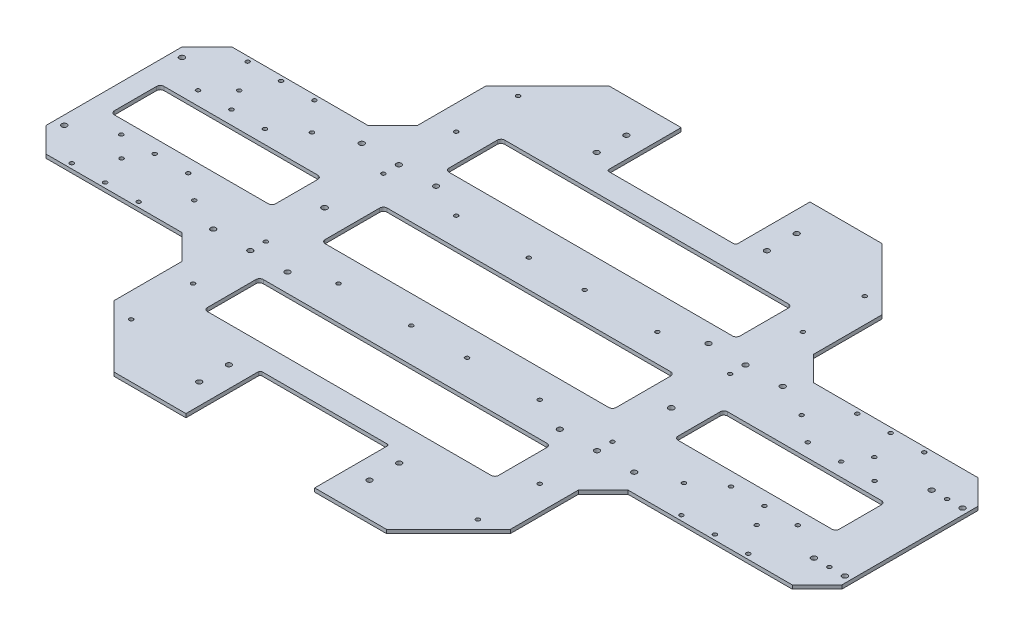
from build123d import *

# Parameters (mm, degrees)
EXTRUDE_1_DEPTH     = 3
CHAMFER_1_SIZE      = 20
CHAMFER_2_SIZE      = 50
SKETCH_2_W          = 104
SKETCH_2_H          = 93.088788678
CUT_EXTRUDE_1_DEPTH = 40
FILLET_1_R          = 1.5
SKETCH_3_R          = 2.1
CUT_EXTRUDE_2_DEPTH = 80
SKETCH_4_R          = 1.6
SKETCH_4_R_2        = 2.1
CUT_EXTRUDE_3_DEPTH = 29
EXTRUDE_2_DEPTH     = 3
SKETCH_6_R          = 2.15
CUT_EXTRUDE_4_DEPTH = 3
CUT_EXTRUDE_5_DEPTH = 15
SKETCH_8_R          = 2.240696867
SKETCH_8_R_2        = 1.6
SKETCH_8_R_3        = 2.15
CUT_EXTRUDE_6_DEPTH = 15


with BuildPart() as part:
    # 草图1 → 凸台-拉伸1 (new body)
    with BuildSketch(Plane(origin=(0, 0, 0), x_dir=(1, 0, 0), z_dir=(0, 1, 0))):
        Polygon((-310, -75), (-160, -75), (-160, -200), (160, -200), (160, -75), (310, -75), (310, 75), (160, 75), (160, 200), (-160, 200), (-160, 75), (-310, 75), align=None)
    extrude(amount=EXTRUDE_1_DEPTH)

    # 倒角1
    chamfer_1_edges = [part.edges().sort_by_distance(p)[0] for p in [
        (-160, 1.5, -75),
        (-310, 1.5, -75),
        (-310, 1.5, 75),
        (-160, 1.5, 75),
        (160, 1.5, 75),
        (160, 1.5, -75),
        (310, 1.5, 75),
        (310, 1.5, -75),
    ]]
    chamfer(chamfer_1_edges, length=CHAMFER_1_SIZE)

    # 倒角2
    chamfer_2_edges = [part.edges().sort_by_distance(p)[0] for p in [
        (160, 1.5, 200),
        (-160, 1.5, 200),
        (160, 1.5, -200),
        (-160, 1.5, -200),
    ]]
    chamfer(chamfer_2_edges, length=CHAMFER_2_SIZE)

    # 草图2 → 切除-拉伸1 (cut)
    with BuildSketch(Plane(origin=(0, 0, 0), x_dir=(-1, 0, 0), z_dir=(0, -1, 0))):
        with Locations((0, -186.544394339)):
            Rectangle(SKETCH_2_W, SKETCH_2_H)
        with Locations((0, 186.544394339)):
            Rectangle(SKETCH_2_W, SKETCH_2_H)
    extrude(amount=-CUT_EXTRUDE_1_DEPTH, mode=Mode.SUBTRACT)

    # 圆角1
    fillet_1_edges = [part.edges().sort_by_distance(p)[0] for p in [
        (-52, 1.5, -140),
        (52, 1.5, -140),
        (52, 1.5, 140),
        (-52, 1.5, 140),
    ]]
    fillet(fillet_1_edges, radius=FILLET_1_R)

    # 草图3 → 切除-拉伸2 (cut)
    with BuildSketch(Plane.XZ):
        with Locations((-68.75, 172.5)):
            Circle(SKETCH_3_R)
        with Locations((-68.75, 148.5)):
            Circle(SKETCH_3_R)
        with Locations((68.75, 172.5)):
            Circle(SKETCH_3_R)
        with Locations((68.75, 148.5)):
            Circle(SKETCH_3_R)
        with Locations((-68.75, -148.5)):
            Circle(SKETCH_3_R)
        with Locations((-68.75, -172.5)):
            Circle(SKETCH_3_R)
        with Locations((68.75, -148.5)):
            Circle(SKETCH_3_R)
        with Locations((68.75, -172.5)):
            Circle(SKETCH_3_R)
    extrude(amount=-CUT_EXTRUDE_2_DEPTH, mode=Mode.SUBTRACT)

    # 草图4 → 切除-拉伸3 (cut)
    with BuildSketch(Plane.XZ):
        with Locations((273.200177837, 71)):
            Circle(SKETCH_4_R)
        with Locations((273.200177837, 30.998400192)):
            Circle(SKETCH_4_R)
        with Locations((246.200177837, 71)):
            Circle(SKETCH_4_R)
        with Locations((219.200177837, 71)):
            Circle(SKETCH_4_R)
        with Locations((246.200177837, 30.998400192)):
            Circle(SKETCH_4_R)
        with Locations((219.200177837, 30.998400192)):
            Circle(SKETCH_4_R)
        with Locations((110, 60)):
            Circle(SKETCH_4_R_2)
        with Locations((140, 60)):
            Circle(SKETCH_4_R_2)
        with Locations((170, 60)):
            Circle(SKETCH_4_R_2)
        with Locations((170, -60)):
            Circle(SKETCH_4_R_2)
        with Locations((140, -60)):
            Circle(SKETCH_4_R_2)
        with Locations((110, -60)):
            Circle(SKETCH_4_R_2)
        with Locations((219.200177837, -30.998400192)):
            Circle(SKETCH_4_R)
        with Locations((246.200177837, -30.998400192)):
            Circle(SKETCH_4_R)
        with Locations((219.200177837, -71)):
            Circle(SKETCH_4_R)
        with Locations((246.200177837, -71)):
            Circle(SKETCH_4_R)
        with Locations((273.200177837, -30.998400192)):
            Circle(SKETCH_4_R)
        with Locations((273.200177837, -71)):
            Circle(SKETCH_4_R)
        with Locations((-273.200177837, -71)):
            Circle(SKETCH_4_R)
        with Locations((-273.200177837, -30.998400192)):
            Circle(SKETCH_4_R)
        with Locations((-246.200177837, -71)):
            Circle(SKETCH_4_R)
        with Locations((-219.200177837, -71)):
            Circle(SKETCH_4_R)
        with Locations((-246.200177837, -30.998400192)):
            Circle(SKETCH_4_R)
        with Locations((-219.200177837, -30.998400192)):
            Circle(SKETCH_4_R)
        with Locations((-110, -60)):
            Circle(SKETCH_4_R_2)
        with Locations((-140, -60)):
            Circle(SKETCH_4_R_2)
        with Locations((-170, -60)):
            Circle(SKETCH_4_R_2)
        with Locations((-170, 60)):
            Circle(SKETCH_4_R_2)
        with Locations((-140, 60)):
            Circle(SKETCH_4_R_2)
        with Locations((-110, 60)):
            Circle(SKETCH_4_R_2)
        with Locations((-219.200177837, 30.998400192)):
            Circle(SKETCH_4_R)
        with Locations((-246.200177837, 30.998400192)):
            Circle(SKETCH_4_R)
        with Locations((-219.200177837, 71)):
            Circle(SKETCH_4_R)
        with Locations((-246.200177837, 71)):
            Circle(SKETCH_4_R)
        with Locations((-273.200177837, 30.998400192)):
            Circle(SKETCH_4_R)
        with Locations((-273.200177837, 71)):
            Circle(SKETCH_4_R)
    extrude(amount=-CUT_EXTRUDE_3_DEPTH, mode=Mode.SUBTRACT)

    # 草图5 → 凸台-拉伸2 (add)
    with BuildSketch(Plane.XZ):
        Polygon((310, 55), (290, 75), (312.700177837, 75), (332.700177837, 55), (332.700177837, -55), (312.700177837, -75), (290, -75), (310, -55), align=None)
    extrude(amount=-EXTRUDE_2_DEPTH)

    # 草图6 → 切除-拉伸4 (cut)
    with BuildSketch(Plane.XZ):
        with Locations((302.700177837, 47.5)):
            Circle(SKETCH_6_R)
        with Locations((327.700177837, 47.5)):
            Circle(SKETCH_6_R)
        with Locations((327.700177837, -47.5)):
            Circle(SKETCH_6_R)
        with Locations((302.700177837, -47.5)):
            Circle(SKETCH_6_R)
    extrude(amount=-CUT_EXTRUDE_4_DEPTH, mode=Mode.SUBTRACT)

    # 草图7 → 切除-拉伸5 (cut)
    with BuildSketch(Plane.XZ):
        with BuildLine():
            Line((289.700177837, -20), (165.5, -20))
            ThreePointArc((165.5, -20), (163.378679656, -19.121320344), (162.5, -17))
            Line((162.5, -17), (162.5, 17))
            ThreePointArc((162.5, 17), (163.378679656, 19.121320344), (165.5, 20))
            Line((165.5, 20), (289.700177837, 20))
            ThreePointArc((289.700177837, 20), (291.82149818, 19.121320344), (292.700177837, 17))
            Line((292.700177837, 17), (292.700177837, -17))
            ThreePointArc((292.700177837, -17), (291.82149818, -19.121320344), (289.700177837, -20))
        make_face()
        with BuildLine():
            Line((114.5, -25), (-114.5, -25))
            ThreePointArc((-114.5, -25), (-116.621320344, -24.121320344), (-117.5, -22))
            Line((-117.5, -22), (-117.5, 22))
            ThreePointArc((-117.5, 22), (-116.621320344, 24.121320344), (-114.5, 25))
            Line((-114.5, 25), (114.5, 25))
            ThreePointArc((114.5, 25), (116.621320344, 24.121320344), (117.5, 22))
            Line((117.5, 22), (117.5, -22))
            ThreePointArc((117.5, -22), (116.621320344, -24.121320344), (114.5, -25))
        make_face()
        with BuildLine():
            Line((114.5, -120), (-114.5, -120))
            ThreePointArc((-114.5, -120), (-116.621320344, -119.121320344), (-117.5, -117))
            Line((-117.5, -117), (-117.5, -78))
            ThreePointArc((-117.5, -78), (-116.621320344, -75.878679656), (-114.5, -75))
            Line((-114.5, -75), (114.5, -75))
            ThreePointArc((114.5, -75), (116.621320344, -75.878679656), (117.5, -78))
            Line((117.5, -78), (117.5, -117))
            ThreePointArc((117.5, -117), (116.621320344, -119.121320344), (114.5, -120))
        make_face()
        with BuildLine():
            Line((-162.5, -17), (-162.5, 17))
            ThreePointArc((-162.5, 17), (-163.378679656, 19.121320344), (-165.5, 20))
            Line((-165.5, 20), (-289.700177837, 20))
            ThreePointArc((-289.700177837, 20), (-291.82149818, 19.121320344), (-292.700177837, 17))
            Line((-292.700177837, 17), (-292.700177837, -17))
            ThreePointArc((-292.700177837, -17), (-291.82149818, -19.121320344), (-289.700177837, -20))
            Line((-289.700177837, -20), (-165.5, -20))
            ThreePointArc((-165.5, -20), (-163.378679656, -19.121320344), (-162.5, -17))
        make_face()
        with BuildLine():
            Line((-117.5, 117), (-117.5, 78))
            ThreePointArc((-117.5, 78), (-116.621320344, 75.878679656), (-114.5, 75))
            Line((-114.5, 75), (114.5, 75))
            ThreePointArc((114.5, 75), (116.621320344, 75.878679656), (117.5, 78))
            Line((117.5, 78), (117.5, 117))
            ThreePointArc((117.5, 117), (116.621320344, 119.121320344), (114.5, 120))
            Line((114.5, 120), (-114.5, 120))
            ThreePointArc((-114.5, 120), (-116.621320344, 119.121320344), (-117.5, 117))
        make_face()
    extrude(amount=-CUT_EXTRUDE_5_DEPTH, mode=Mode.SUBTRACT)

    # 草图8 → 切除-拉伸6 (cut)
    with BuildSketch(Plane.XZ):
        with Locations((140, 0)):
            Circle(SKETCH_8_R)
        with Locations((140, 156.23)):
            Circle(SKETCH_8_R_2)
        with Locations((140, 106.23)):
            Circle(SKETCH_8_R_2)
        with Locations((22.54, 47.5)):
            Circle(SKETCH_8_R_2)
        with Locations((81.27, 47.5)):
            Circle(SKETCH_8_R_2)
        with Locations((140, 47.5)):
            Circle(SKETCH_8_R_2)
        with Locations((197.736844504, 47.5)):
            Circle(SKETCH_8_R_2)
        with Locations((256.466844504, 47.5)):
            Circle(SKETCH_8_R_2)
        with Locations((315.200177837, 47.5)):
            Circle(SKETCH_8_R_2)
        with Locations((315.200177837, -47.5)):
            Circle(SKETCH_8_R_2)
        with Locations((256.466844504, -47.5)):
            Circle(SKETCH_8_R_2)
        with Locations((197.736844504, -47.5)):
            Circle(SKETCH_8_R_2)
        with Locations((140, -47.5)):
            Circle(SKETCH_8_R_2)
        with Locations((81.27, -47.5)):
            Circle(SKETCH_8_R_2)
        with Locations((22.54, -47.5)):
            Circle(SKETCH_8_R_2)
        with Locations((140, -106.23)):
            Circle(SKETCH_8_R_2)
        with Locations((140, -156.23)):
            Circle(SKETCH_8_R_2)
        with Locations((-140, -156.23)):
            Circle(SKETCH_8_R_2)
        with Locations((-140, -106.23)):
            Circle(SKETCH_8_R_2)
        with Locations((-22.54, -47.5)):
            Circle(SKETCH_8_R_2)
        with Locations((-81.27, -47.5)):
            Circle(SKETCH_8_R_2)
        with Locations((-140, -47.5)):
            Circle(SKETCH_8_R_2)
        with Locations((-197.736844504, -47.5)):
            Circle(SKETCH_8_R_2)
        with Locations((-256.466844504, -47.5)):
            Circle(SKETCH_8_R_2)
        with Locations((-315.200177837, -47.5)):
            Circle(SKETCH_8_R_2)
        with Locations((-315.200177837, 47.5)):
            Circle(SKETCH_8_R_2)
        with Locations((-256.466844504, 47.5)):
            Circle(SKETCH_8_R_2)
        with Locations((-197.736844504, 47.5)):
            Circle(SKETCH_8_R_2)
        with Locations((-140, 47.5)):
            Circle(SKETCH_8_R_2)
        with Locations((-81.27, 47.5)):
            Circle(SKETCH_8_R_2)
        with Locations((-22.54, 47.5)):
            Circle(SKETCH_8_R_2)
        with Locations((-140, 106.23)):
            Circle(SKETCH_8_R_2)
        with Locations((-140, 156.23)):
            Circle(SKETCH_8_R_2)
        with Locations((-140, 0)):
            Circle(SKETCH_8_R)
        with Locations((-302.700177837, -47.5)):
            Circle(SKETCH_8_R_3)
        with Locations((-302.700177837, 47.5)):
            Circle(SKETCH_8_R_3)
    extrude(amount=-CUT_EXTRUDE_6_DEPTH, mode=Mode.SUBTRACT)


solid = part.part
